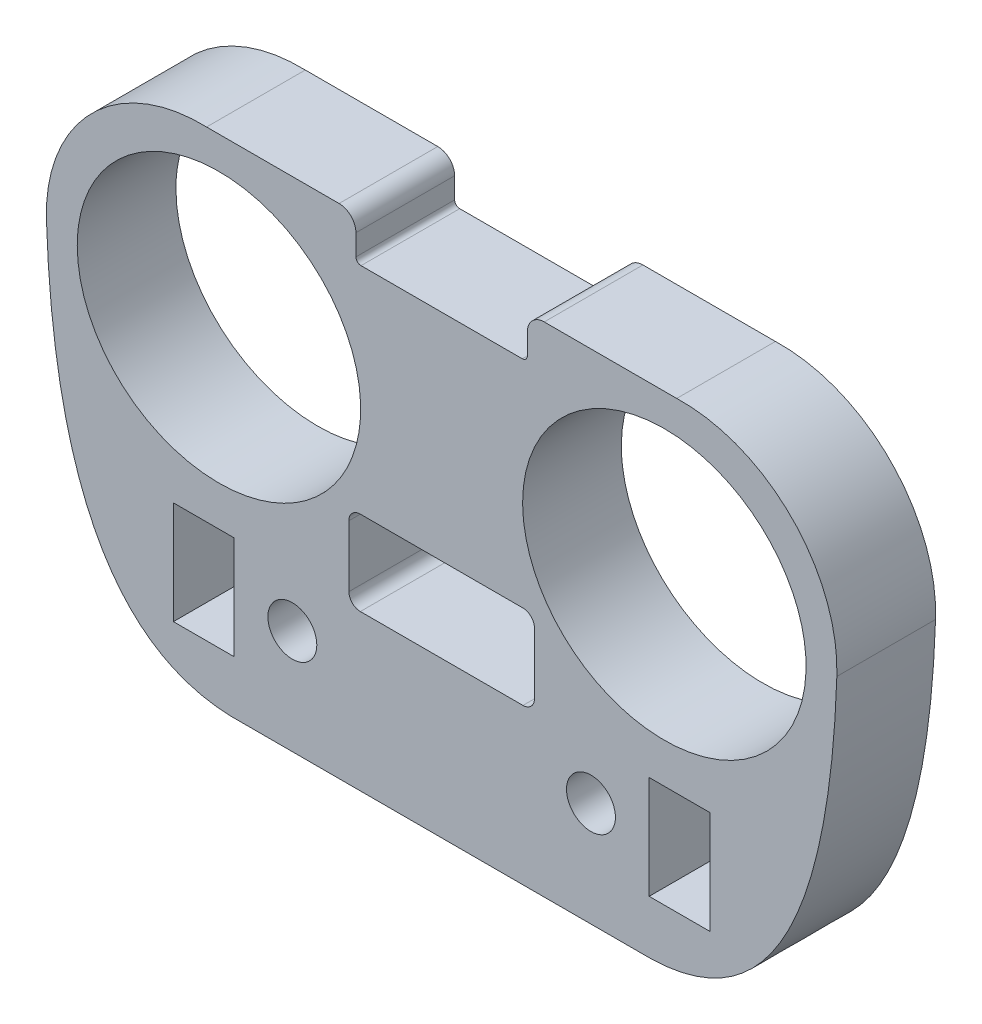
from build123d import *

# Parameters (mm, degrees)
MODEL_W             = 3.6
MODEL_H             = 6.1
MODEL_R             = 1.45
BOSS_EXTRUDE1_DEPTH = 5.85
FILLET1_R           = 0.3
FILLET2_R           = 1


with BuildPart() as part:
    # Model → Boss-Extrude1 (new body)
    with BuildSketch(Plane.XY):
        with BuildLine():
            Line((549.596103149, 594.649674665), (540.7427075, 594.649674665))
            ThreePointArc((540.7427075, 594.649674665), (533.932980762, 591.943953999), (531.251426748, 585.124674665))
            add(Edge.make_bspline(
                [(531.251426748, 585.124674665), (531.926909632, 565.444526899), (542.192175731, 565.124674665)],
                knots=[0, 0, 0, 1, 1, 1], degree=2))
            Line((542.192175731, 565.124674665), (567.160030567, 565.124674665))
            add(Edge.make_bspline(
                [(578.10077955, 585.124674665), (577.425296665, 565.444526899), (567.160030567, 565.124674665)],
                knots=[0, 0, 0, 1, 1, 1], degree=2))
            ThreePointArc((578.10077955, 585.124674665), (575.419225536, 591.943953999), (568.609498798, 594.649674665))
            Line((568.609498798, 594.649674665), (559.756103149, 594.649674665))
            Line((559.756103149, 594.649674665), (559.756103149, 592.109674665))
            Line((559.756103149, 592.109674665), (549.596103149, 592.109674665))
            Line((549.596103149, 592.109674665), (549.596103149, 594.649674665))
        make_face()
        with Locations((540.576103149, 571.324674665)):
            Rectangle(MODEL_W, MODEL_H, mode=Mode.SUBTRACT)
        with Locations((545.826103149, 571.324674665)):
            Circle(MODEL_R, mode=Mode.SUBTRACT)
        with Locations((563.526103149, 571.324674665)):
            Circle(MODEL_R, mode=Mode.SUBTRACT)
        with Locations((568.776103149, 571.324674665)):
            Rectangle(MODEL_W, MODEL_H, mode=Mode.SUBTRACT)
        with BuildLine():
            Line((554.676103149, 574.334674665), (549.856103149, 574.334674665))
            ThreePointArc((549.856103149, 574.334674665), (549.375270538, 574.533842054), (549.176103149, 575.014674665))
            Line((549.176103149, 575.014674665), (549.176103149, 578.654674665))
            ThreePointArc((549.176103149, 578.654674665), (549.375270538, 579.135507276), (549.856103149, 579.334674665))
            Line((549.856103149, 579.334674665), (554.676103149, 579.334674665))
            Line((554.676103149, 579.334674665), (559.496103149, 579.334674665))
            ThreePointArc((559.496103149, 579.334674665), (559.97693576, 579.135507276), (560.176103149, 578.654674665))
            Line((560.176103149, 578.654674665), (560.176103149, 575.014674665))
            ThreePointArc((560.176103149, 575.014674665), (559.97693576, 574.533842054), (559.496103149, 574.334674665))
            Line((559.496103149, 574.334674665), (554.676103149, 574.334674665))
        make_face(mode=Mode.SUBTRACT)
        with BuildLine():
            add(Edge.make_bspline(
                [(533.076103149, 584.734674665), (533.076103149, 570.878268205), (545.676103149, 577.806471435), (558.276103149, 584.734674665), (545.676103149, 591.662877895), (533.076103149, 598.591081126), (533.076103149, 584.734674665)],
                knots=[0, 0, 0, 2.094395102, 2.094395102, 4.188790205, 4.188790205, 6.283185307, 6.283185307, 6.283185307], degree=2, weights=[1, 0.5, 1, 0.5, 1, 0.5, 1]))
        make_face(mode=Mode.SUBTRACT)
        with BuildLine():
            add(Edge.make_bspline(
                [(559.476103149, 584.734674665), (559.476103149, 570.878268205), (572.076103149, 577.806471435), (584.676103149, 584.734674665), (572.076103149, 591.662877895), (559.476103149, 598.591081126), (559.476103149, 584.734674665)],
                knots=[0, 0, 0, 2.094395102, 2.094395102, 4.188790205, 4.188790205, 6.283185307, 6.283185307, 6.283185307], degree=2, weights=[1, 0.5, 1, 0.5, 1, 0.5, 1]))
        make_face(mode=Mode.SUBTRACT)
    extrude(amount=BOSS_EXTRUDE1_DEPTH)

    # Fillet1
    fillet1_edges = [part.edges().sort_by_distance(p)[0] for p in [
        (559.756103149, 592.109674665, 2.925),
        (549.596103149, 592.109674665, 2.925),
    ]]
    fillet(fillet1_edges, radius=FILLET1_R)

    # Fillet2
    fillet2_edges = [part.edges().sort_by_distance(p)[0] for p in [
        (559.756103149, 594.649674665, 2.925),
        (549.596103149, 594.649674665, 2.925),
    ]]
    fillet(fillet2_edges, radius=FILLET2_R)


solid = part.part
